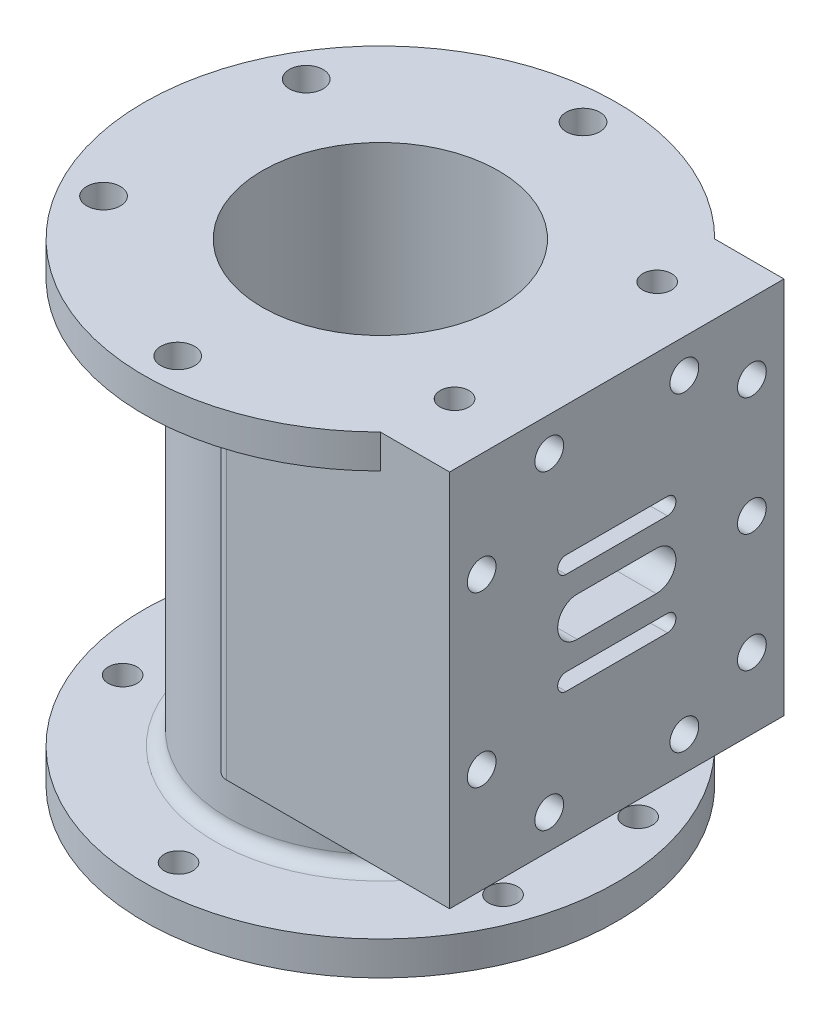
from build123d import *

# Parameters (mm, degrees)
CUT_EXTRUDE1_REACH          = 110.88
SKETCH5_R                   = 3.175
SKETCH3_W                   = 62.865
SKETCH3_H                   = 71.12
BOSS_EXTRUDE3_DEPTH         = 44.45
SKETCH8_R                   = 22.225
CUT_EXTRUDE3_DEPTH          = 109.879819067
FILLET1_R                   = 2.54
FILLET2_R                   = 2.54
F_1_4_28_TAPPED_HOLE1_D     = 5.4102
F_1_4_28_TAPPED_HOLE1_DEPTH = 12.7
F_1_4_28_TAPPED_HOLE1_TIP   = 1.625388061
F_1_4_28_TAPPED_HOLE7_D     = 5.4102
F_1_4_28_TAPPED_HOLE7_DEPTH = 6.35
F_1_4_28_TAPPED_HOLE8_D     = 5.4102
F_1_4_28_TAPPED_HOLE8_DEPTH = 12.7
F_1_4_28_TAPPED_HOLE8_TIP   = 1.625388061
CUT_EXTRUDE4_DEPTH          = 11.43
CUT_EXTRUDE6_DEPTH          = 9.525
CUT_EXTRUDE6_DEPTH_BACK     = 9.525
F_1_4_28_TAPPED_HOLE9_D     = 5.4102
F_1_4_28_TAPPED_HOLE9_DEPTH = 12.7
F_1_4_28_TAPPED_HOLE9_TIP   = 1.625388061


with BuildPart() as part:
    # Sketch2 → Revolve1 (revolve)
    with BuildSketch(Plane.XY, mode=Mode.PRIVATE) as revolve1_sk:
        Polygon((-22.225, 38.508849789), (-44.45, 38.508849789), (-44.45, 32.158849789), (-28.575, 32.158849789), (-28.575, -44.041150211), (-44.45, -44.041150211), (-44.45, -50.391150211), (-22.225, -50.391150211), (-22.225, 26.465672677), align=None)
    revolve(revolve1_sk.sketch.rotate(Axis((0, -56.084327323, 0), (0, 1, 0)), 270), axis=Axis((0, -56.084327323, 0), (0, 1, 0)))

    # Sketch5 → Cut-Extrude1 (cut, up to next)
    with BuildSketch(Plane(origin=(0, 38.508849789, 0), x_dir=(1, 0, 0), z_dir=(0, 1, 0)), mode=Mode.PRIVATE) as cut_extrude1_sk1:
        with Locations(Location((0, 38.1, 0), (0, 0, 270))):
            Circle(SKETCH5_R)
    cut_extrude1_tool1 = extrude(cut_extrude1_sk1.sketch, amount=-CUT_EXTRUDE1_REACH, mode=Mode.PRIVATE) & part.part
    # Sketch5 → Cut-Extrude1 (cut, up to next)
    with BuildSketch(Plane(origin=(0, 38.508849789, 0), x_dir=(1, 0, 0), z_dir=(0, 1, 0)), mode=Mode.PRIVATE) as cut_extrude1_sk2:
        with Locations(Location((32.995567884, 19.05, 0), (0, 0, 270))):
            Circle(SKETCH5_R)
    cut_extrude1_tool2 = extrude(cut_extrude1_sk2.sketch, amount=-CUT_EXTRUDE1_REACH, mode=Mode.PRIVATE) & part.part
    # Sketch5 → Cut-Extrude1 (cut, up to next)
    with BuildSketch(Plane(origin=(0, 38.508849789, 0), x_dir=(1, 0, 0), z_dir=(0, 1, 0)), mode=Mode.PRIVATE) as cut_extrude1_sk3:
        with Locations(Location((32.995567884, -19.05, 0), (0, 0, 270))):
            Circle(SKETCH5_R)
    cut_extrude1_tool3 = extrude(cut_extrude1_sk3.sketch, amount=-CUT_EXTRUDE1_REACH, mode=Mode.PRIVATE) & part.part
    # Sketch5 → Cut-Extrude1 (cut, up to next)
    with BuildSketch(Plane(origin=(0, 38.508849789, 0), x_dir=(1, 0, 0), z_dir=(0, 1, 0)), mode=Mode.PRIVATE) as cut_extrude1_sk4:
        with Locations(Location((0, -38.1, 0), (0, 0, 270))):
            Circle(SKETCH5_R)
    cut_extrude1_tool4 = extrude(cut_extrude1_sk4.sketch, amount=-CUT_EXTRUDE1_REACH, mode=Mode.PRIVATE) & part.part
    # Sketch5 → Cut-Extrude1 (cut, up to next)
    with BuildSketch(Plane(origin=(0, 38.508849789, 0), x_dir=(1, 0, 0), z_dir=(0, 1, 0)), mode=Mode.PRIVATE) as cut_extrude1_sk5:
        with Locations(Location((-32.995567884, -19.05, 0), (0, 0, 270))):
            Circle(SKETCH5_R)
    cut_extrude1_tool5 = extrude(cut_extrude1_sk5.sketch, amount=-CUT_EXTRUDE1_REACH, mode=Mode.PRIVATE) & part.part
    # Sketch5 → Cut-Extrude1 (cut, up to next)
    with BuildSketch(Plane(origin=(0, 38.508849789, 0), x_dir=(1, 0, 0), z_dir=(0, 1, 0)), mode=Mode.PRIVATE) as cut_extrude1_sk6:
        with Locations(Location((-32.995567884, 19.05, 0), (0, 0, 270))):
            Circle(SKETCH5_R)
    cut_extrude1_tool6 = extrude(cut_extrude1_sk6.sketch, amount=-CUT_EXTRUDE1_REACH, mode=Mode.PRIVATE) & part.part
    add(cut_extrude1_tool1.solids().sort_by_distance((0, 38.50885, -38.1))[0], mode=Mode.SUBTRACT)
    add(cut_extrude1_tool2.solids().sort_by_distance((32.995568, 38.50885, -19.05))[0], mode=Mode.SUBTRACT)
    add(cut_extrude1_tool3.solids().sort_by_distance((32.995568, 38.50885, 19.05))[0], mode=Mode.SUBTRACT)
    add(cut_extrude1_tool4.solids().sort_by_distance((0, 38.50885, 38.1))[0], mode=Mode.SUBTRACT)
    add(cut_extrude1_tool5.solids().sort_by_distance((-32.995568, 38.50885, 19.05))[0], mode=Mode.SUBTRACT)
    add(cut_extrude1_tool6.solids().sort_by_distance((-32.995568, 38.50885, -19.05))[0], mode=Mode.SUBTRACT)

    # Sketch3 → Boss-Extrude3 (add)
    with BuildSketch(Plane(origin=(44.45, 0, 0), x_dir=(0, 0, -1), z_dir=(1, 0, 0))):
        with Locations((0, 2.948849789)):
            Rectangle(SKETCH3_W, SKETCH3_H)
    extrude(amount=-BOSS_EXTRUDE3_DEPTH)

    # Sketch8 → Cut-Extrude3 (cut, through all)
    with BuildSketch(Plane(origin=(0, 38.508849789, 0), x_dir=(1, 0, 0), z_dir=(0, 1, 0))):
        with Locations(Location((0, 0, 0), (0, 0, 90))):
            Circle(SKETCH8_R)
    extrude(amount=-CUT_EXTRUDE3_DEPTH, mode=Mode.SUBTRACT)

    # Fillet1
    fillet1_edges = [part.edges().sort_by_distance(p)[0] for p in [
        (0, -0.226150211, -31.4325),
        (0, -0.226150211, 31.4325),
    ]]
    fillet(fillet1_edges, radius=FILLET1_R)

    # Fillet2
    # the kernel refuses this fillet: 2.54 mm, written as the material it adds along each edge
    with BuildSketch(Plane(origin=(0, 32.158849789, 0), x_dir=(0.22074631689702245, 0, -0.9753312583816841), z_dir=(0.9753312583816841, 0, 0.22074631689702245))) as fillet2_piece_1:
        with BuildLine():
            CenterArc((28.575 + FILLET2_R, -FILLET2_R), FILLET2_R, 90, 90)
            Line((28.575, -FILLET2_R), (28.575, 0))
            Line((28.575, 0), (28.575 + FILLET2_R, 0))
        make_face()
    revolve(axis=Axis((0, 32.158849789, 0), (0, 1, 0)), revolution_arc=205.505743093)
    with BuildSketch(Plane(origin=(0, -44.041150211, 0), x_dir=(0, 0, -1), z_dir=(1, 0, 0))) as fillet2_piece_2:
        with BuildLine():
            CenterArc((28.575 + FILLET2_R, FILLET2_R), FILLET2_R, 180, 90)
            Line((28.575 + FILLET2_R, 0), (28.575, 0))
            Line((28.575, 0), (28.575, FILLET2_R))
        make_face()
    revolve(axis=Axis((0, -44.041150211, 0), (0, 1, 0)))

    # 1/4-28 Tapped Hole1
    with Locations(Plane(origin=(44.45, 32.158849789, 12.7), x_dir=(0, 0, 1), z_dir=(1, 0, 0))):
        with Locations((0, 0), (-25.4, 0), (-38.1, 6.985), (-38.1, 29.21), (-38.1, 51.435), (-25.4, 58.42), (0, 58.42)):
            Hole(F_1_4_28_TAPPED_HOLE1_D / 2, depth=F_1_4_28_TAPPED_HOLE1_DEPTH)
            with Locations((0, 0, -(F_1_4_28_TAPPED_HOLE1_DEPTH + F_1_4_28_TAPPED_HOLE1_TIP / 2))):  # 118° drill point
                Cone(0, F_1_4_28_TAPPED_HOLE1_D / 2, F_1_4_28_TAPPED_HOLE1_TIP, mode=Mode.SUBTRACT)

    # 1/4-28 Tapped Hole7
    with Locations(Plane(origin=(0, -50.391150211, -37.949057556), x_dir=(0, 0, -1), z_dir=(0, -1, 0))):
        with Locations((0, 0), (-25.249057556, 35.760886026), (-50.649057556, 35.760886026), (-25.249057556, -35.760886026), (-50.649057556, -35.760886026), (-75.898115112, 0)):
            Hole(F_1_4_28_TAPPED_HOLE7_D / 2, depth=F_1_4_28_TAPPED_HOLE7_DEPTH)

    # 1/4-28 Tapped Hole8
    with Locations(Plane(origin=(32.995567884, 38.508849789, -19.05), x_dir=(0, 0, 1), z_dir=(0, 1, 0))):
        with Locations((0, 0), (38.1, 0)):
            Hole(F_1_4_28_TAPPED_HOLE8_D / 2, depth=F_1_4_28_TAPPED_HOLE8_DEPTH)
            with Locations((0, 0, -(F_1_4_28_TAPPED_HOLE8_DEPTH + F_1_4_28_TAPPED_HOLE8_TIP / 2))):  # 118° drill point
                Cone(0, F_1_4_28_TAPPED_HOLE8_D / 2, F_1_4_28_TAPPED_HOLE8_TIP, mode=Mode.SUBTRACT)

    # Sketch13 → Cut-Extrude4 (cut)
    with BuildSketch(Plane(origin=(44.45, 0, 0), x_dir=(0, 0, -1), z_dir=(1, 0, 0))):
        with BuildLine():
            Line((9.525, 14.061349789), (-9.525, 14.061349789))
            ThreePointArc((-9.525, 14.061349789), (-11.1125, 12.473849789), (-9.525, 10.886349789))
            Line((-9.525, 10.886349789), (9.525, 10.886349789))
            ThreePointArc((9.525, 10.886349789), (11.1125, 12.473849789), (9.525, 14.061349789))
        make_face()
        with BuildLine():
            Line((7.4295, 6.631849789), (-7.4295, 6.631849789))
            ThreePointArc((-7.4295, 6.631849789), (-11.1125, 2.948849789), (-7.4295, -0.734150211))
            Line((-7.4295, -0.734150211), (7.4295, -0.734150211))
            ThreePointArc((7.4295, -0.734150211), (11.1125, 2.948849789), (7.4295, 6.631849789))
        make_face()
        with BuildLine():
            Line((-9.525, -8.163650211), (9.525, -8.163650211))
            ThreePointArc((9.525, -8.163650211), (11.1125, -6.576150211), (9.525, -4.988650211))
            Line((9.525, -4.988650211), (-9.525, -4.988650211))
            ThreePointArc((-9.525, -4.988650211), (-11.1125, -6.576150211), (-9.525, -8.163650211))
        make_face()
    extrude(amount=-CUT_EXTRUDE4_DEPTH, mode=Mode.SUBTRACT)

    # Sketch22 → Cut-Extrude6 (cut, two sides: drawn at the far end of the back side and taken through both)
    with BuildSketch(Plane.XY.offset(-CUT_EXTRUDE6_DEPTH_BACK)):
        Polygon((33.02, 14.061349789), (22.118863764, 33.487032124), (22.118863764, 36.643703979), (34.791433783, 14.061349789), align=None)
        Polygon((33.02, -8.163650211), (22.118863764, -46.84942144), (22.118863764, -51.230401207), (34.25450188, -8.163650211), align=None)
    extrude(amount=CUT_EXTRUDE6_DEPTH + CUT_EXTRUDE6_DEPTH_BACK, mode=Mode.SUBTRACT)

    # 1/4-28 Tapped Hole9
    with Locations(Plane(origin=(44.45, -12.926150211, 25.4), x_dir=(0, 0, 1), z_dir=(1, 0, 0))):
        with Locations((0, 0), (0, -31.75)):
            Hole(F_1_4_28_TAPPED_HOLE9_D / 2, depth=F_1_4_28_TAPPED_HOLE9_DEPTH)
            with Locations((0, 0, -(F_1_4_28_TAPPED_HOLE9_DEPTH + F_1_4_28_TAPPED_HOLE9_TIP / 2))):  # 118° drill point
                Cone(0, F_1_4_28_TAPPED_HOLE9_D / 2, F_1_4_28_TAPPED_HOLE9_TIP, mode=Mode.SUBTRACT)


solid = part.part
